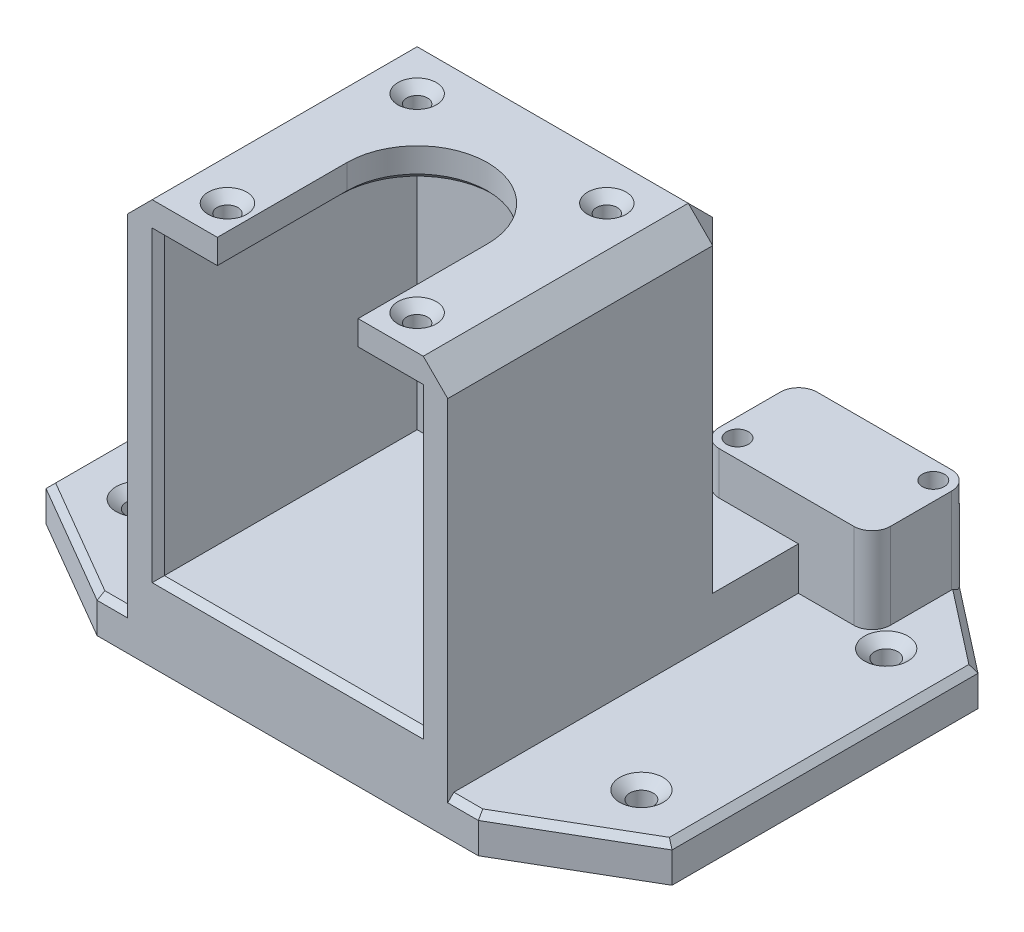
from build123d import *

# Parameters (mm, degrees)
SKETCH2_W                                         = 62.3
SKETCH2_H                                         = 73.3
BOSS_EXTRUDE1_DEPTH                               = 3
BOSS_EXTRUDE3_DEPTH                               = 10
BOSS_EXTRUDE4_DEPTH                               = 48.2
SKETCH13_W                                        = 52.3
SKETCH13_H                                        = 47.3
BOSS_EXTRUDE5_DEPTH                               = 5
CUT_EXTRUDE2_REACH                                = 475.855
CSK_FOR_M3_FLAT_HEAD_MACHINE_SCREW1_D             = 3.4
CSK_FOR_M3_FLAT_HEAD_MACHINE_SCREW1_DEPTH         = 5
CSK_FOR_M3_FLAT_HEAD_MACHINE_SCREW1_CSINK_D       = 6.3
CSK_FOR_M3_FLAT_HEAD_MACHINE_SCREW1_CSINK_ANGLE   = 90
CHAMFER1_SIZE                                     = 1
BOSS_EXTRUDE7_DEPTH                               = 20
BOSS_EXTRUDE6_START                               = -6
BOSS_EXTRUDE6_OUTLINE_W                           = 14
BOSS_EXTRUDE6_OUTLINE_H                           = 20.4
BOSS_EXTRUDE6_DEPTH                               = 6
CHAMFER5_SIZE                                     = 10
CHAMFER2_SIZE                                     = 4
CSK_FOR_6_FLAT_HEAD_MACHINE_SCREW_100_D           = 3.7973
CSK_FOR_6_FLAT_HEAD_MACHINE_SCREW_100_CSINK_D     = 7.0866
CSK_FOR_6_FLAT_HEAD_MACHINE_SCREW_100_CSINK_ANGLE = 100
CHAMFER3_SIZE                                     = 1
F_3_0MM_DOWEL_HOLE1_D                             = 3.5
F_3_32_0_140625_DOWEL_HOLE1_D                     = 3.571875
HOLE4_D                                           = 5.64
HOLE4_DEPTH                                       = 4.2
CUT_EXTRUDE3_DEPTH                                = 4.2
CHAMFER4_SIZE                                     = 0.2


# Read off the part's stored shape, not the designer's step: Boss-Extrude6
with BuildPart() as part:
    # Sketch2 → Boss-Extrude1 (new body)
    with BuildSketch(Plane(origin=(0, -39.89907595, 0), x_dir=(1, 0, 0), z_dir=(0, 1, 0))):
        with Locations((-296.943004764, -298.776222799)):
            Rectangle(SKETCH2_W, SKETCH2_H)
    extrude(amount=BOSS_EXTRUDE1_DEPTH)

    # Sketch4 → Boss-Extrude3 (add)
    with BuildSketch(Plane(origin=(0, -36.89907595, 0), x_dir=(1, 0, 0), z_dir=(0, 1, 0))):
        Polygon((-323.093004764, -262.126222799), (-303.943004764, -262.126222799), (-303.943004764, -282.526222799), (-289.943004764, -282.526222799), (-289.943004764, -262.126222799), (-270.793004764, -262.126222799), (-270.793004764, -335.426222799), (-323.093004764, -335.426222799), align=None)
    extrude(amount=BOSS_EXTRUDE3_DEPTH)

    # Sketch5 → Boss-Extrude4 (add)
    with BuildSketch(Plane(origin=(0, -26.89907595, 0), x_dir=(1, 0, 0), z_dir=(0, 1, 0))):
        Polygon((-270.793004764, -288.126222799), (-323.093004764, -288.126222799), (-323.093004764, -335.426222799), (-318.093004764, -335.426222799), (-318.093004764, -293.126222799), (-275.793004764, -293.126222799), (-275.793004764, -335.426222799), (-270.793004764, -335.426222799), align=None)
    extrude(amount=BOSS_EXTRUDE4_DEPTH)

    # Sketch13 → Boss-Extrude5 (add)
    with BuildSketch(Plane(origin=(0, 21.30092405, 0), x_dir=(1, 0, 0), z_dir=(0, 1, 0))):
        with Locations((-296.943004764, -311.776222799)):
            Rectangle(SKETCH13_W, SKETCH13_H)
    extrude(amount=BOSS_EXTRUDE5_DEPTH)

    # Sketch15 → Cut-Extrude2 (cut, up to next)
    with BuildSketch(Plane(origin=(0, 26.30092405, 0), x_dir=(1, 0, 0), z_dir=(0, 1, 0)), mode=Mode.PRIVATE) as cut_extrude2_sk1:
        with BuildLine():
            Line((-308.443004764, -314.276222799), (-308.443004764, -335.426222799))
            Line((-308.443004764, -335.426222799), (-285.443004764, -335.426222799))
            Line((-285.443004764, -335.426222799), (-285.443004764, -314.276222799))
            ThreePointArc((-285.443004764, -314.276222799), (-296.943004764, -302.776222799), (-308.443004764, -314.276222799))
        make_face()
    cut_extrude2_tool1 = extrude(cut_extrude2_sk1.sketch, amount=-CUT_EXTRUDE2_REACH, mode=Mode.PRIVATE) & part.part
    add(cut_extrude2_tool1.solids().sort_by_distance((-296.943005, 26.300924, 320.226042))[0], mode=Mode.SUBTRACT)

    # CSK for M3 Flat Head Machine Screw1
    with Locations(Plane(origin=(0, 26.30092405, 0), x_dir=(1, 0, 0), z_dir=(0, 1, 0))):
        with Locations((-312.443004764, -298.776222799), (-281.443004764, -298.776222799), (-281.443004764, -329.776222799), (-312.443004764, -329.776222799)):
            CounterSinkHole(CSK_FOR_M3_FLAT_HEAD_MACHINE_SCREW1_D / 2, CSK_FOR_M3_FLAT_HEAD_MACHINE_SCREW1_CSINK_D / 2, depth=CSK_FOR_M3_FLAT_HEAD_MACHINE_SCREW1_DEPTH, counter_sink_angle=CSK_FOR_M3_FLAT_HEAD_MACHINE_SCREW1_CSINK_ANGLE)

    # Chamfer1
    chamfer1_edges = [part.edges().sort_by_distance(p)[0] for p in [
        (-296.943004764, -26.89907595, 335.426222799),
        (-275.793004764, -2.79907595, 335.426222799),
        (-318.093004764, -2.79907595, 335.426222799),
        (-313.268004764, 21.30092405, 335.426222799),
        (-280.618004764, 21.30092405, 335.426222799),
        (-308.443004764, 21.30092405, 324.851222799),
        (-285.443004764, 21.30092405, 324.851222799),
        (-296.943004764, 21.30092405, 302.776222799),
    ]]
    chamfer(chamfer1_edges, length=CHAMFER1_SIZE)

    # Sketch28 → Boss-Extrude7 (add)
    with BuildSketch(Plane(origin=(-288.526747439, -39.89907595, 232.373479331), x_dir=(1, 0, 0), z_dir=(0, 1, 0))):
        with BuildLine():
            Line((29.783182259, -35.452743468), (29.783182259, -32.752743468))
            ThreePointArc((29.783182259, -32.752743468), (28.904502603, -30.631423124), (26.783182259, -29.752743468))
            Line((26.783182259, -29.752743468), (24.083182259, -29.752743468))
            Line((24.083182259, -29.752743468), (4.783182369, -29.752743468))
            ThreePointArc((4.783182369, -29.752743468), (2.661862025, -30.631423124), (1.783182369, -32.752743468))
            Line((1.783182369, -32.752743468), (1.783182259, -40.052743468))
            Line((1.783182259, -40.052743468), (1.783182259, -42.752743468))
            ThreePointArc((1.783182259, -42.752743468), (2.661861916, -44.874063811), (4.783182259, -45.752743468))
            Line((4.783182259, -45.752743468), (7.483182259, -45.752743468))
            Line((7.483182259, -45.752743468), (26.783182369, -45.752743468))
            ThreePointArc((26.783182369, -45.752743468), (28.904502712, -44.874063811), (29.783182369, -42.752743468))
            Line((29.783182369, -42.752743468), (29.783182259, -35.452743468))
        make_face()
    extrude(amount=BOSS_EXTRUDE7_DEPTH)

    # Boss-Extrude6 outline → Boss-Extrude6 (add)
    with BuildSketch(Plane.XZ.offset(39.89907595).offset(BOSS_EXTRUDE6_START)):
        with Locations((-296.943004764, 272.326222799)):
            Rectangle(BOSS_EXTRUDE6_OUTLINE_W, BOSS_EXTRUDE6_OUTLINE_H)
        with BuildLine():
            ThreePointArc((-258.743565179, 265.126222799), (-258.971926582, 263.978172502), (-259.622244836, 263.004902456))
            Line((-259.622244836, 263.004902456), (-245.793004764, 273.776222799))
            Line((-245.793004764, 273.776222799), (-245.793004764, 323.776222799))
            Line((-245.793004764, 323.776222799), (-265.793004764, 335.426222799))
            Line((-265.793004764, 335.426222799), (-270.793004764, 335.426222799))
            Line((-270.793004764, 335.426222799), (-270.793004764, 278.126222799))
            Line((-270.793004764, 278.126222799), (-261.74356507, 278.126222799))
            ThreePointArc((-261.74356507, 278.126222799), (-259.622244726, 277.247543143), (-258.74356507, 275.126222799))
            Line((-258.74356507, 275.126222799), (-258.743565179, 265.126222799))
        make_face()
        Polygon((-328.093004764, 262.126222799), (-323.093004764, 262.126222799), (-323.093004764, 335.426222799), (-328.093004764, 335.426222799), (-348.093004764, 323.776222799), (-348.093004764, 273.776222799), align=None)
    extrude(amount=BOSS_EXTRUDE6_DEPTH)

    # Chamfer5
    chamfer5_edges = [part.edges().sort_by_distance(p)[0] for p in [
        (-323.093004764, -30.39907595, 262.126222799),
    ]]
    chamfer(chamfer5_edges, length=CHAMFER5_SIZE)

    # Chamfer2
    chamfer2_edges = [part.edges().sort_by_distance(p)[0] for p in [
        (-270.793004764, -0.29907595, 288.126222799),
        (-323.093004764, -0.29907595, 288.126222799),
        (-296.943004764, 26.30092405, 288.126222799),
        (-323.093004764, 26.30092405, 311.776222799),
        (-270.793004764, 26.30092405, 311.776222799),
    ]]
    chamfer(chamfer2_edges, length=CHAMFER2_SIZE)

    # CSK for #6 Flat Head Machine Screw (100)1 (through all)
    with Locations(Plane(origin=(0, -33.89907595, 0), x_dir=(1, 0, 0), z_dir=(0, 1, 0))):
        with Locations((-338.093004764, -278.776222799), (-338.093004764, -318.776222799), (-255.793004764, -318.776222799), (-255.793004764, -278.776222799)):
            CounterSinkHole(CSK_FOR_6_FLAT_HEAD_MACHINE_SCREW_100_D / 2, CSK_FOR_6_FLAT_HEAD_MACHINE_SCREW_100_CSINK_D / 2, counter_sink_angle=CSK_FOR_6_FLAT_HEAD_MACHINE_SCREW_100_CSINK_ANGLE)

    # Chamfer3
    chamfer3_edges = [part.edges().sort_by_distance(p)[0] for p in [
        (-286.843284917, -26.89907595, 262.126222799),
        (-268.293004764, -33.89907595, 335.426222799),
        (-303.943004764, -26.89907595, 272.326222799),
        (-255.793004764, -33.89907595, 329.601222799),
        (-245.793004764, -33.89907595, 298.776222799),
        (-252.7076248, -33.89907595, 268.390562628),
        (-308.518004764, -26.89907595, 262.126222799),
        (-348.093004764, -33.89907595, 298.776222799),
        (-338.093004764, -33.89907595, 329.601222799),
        (-325.593004764, -33.89907595, 335.426222799),
        (-318.093004764, -33.89907595, 262.126222799),
        (-338.093004764, -33.89907595, 267.951222799),
        (-289.943004764, -26.89907595, 272.326222799),
        (-296.943004764, -26.89907595, 282.526222799),
        (-323.093004764, -26.89907595, 282.126222799),
        (-318.093004764, -26.89907595, 267.126222799),
    ]]
    chamfer(chamfer3_edges, length=CHAMFER3_SIZE)

    # Ø3.0mm Dowel Hole1 (through all)
    with Locations(Plane(origin=(0, -33.89907595, 0), x_dir=(1, 0, 0), z_dir=(0, 1, 0))):
        with Locations((-296.943004764, -272.326222799)):
            Hole(F_3_0MM_DOWEL_HOLE1_D / 2)

    # 3/32 (0.140625) Dowel Hole1 (through all)
    with Locations(Plane(origin=(0, -19.89907595, 0), x_dir=(1, 0, 0), z_dir=(0, 1, 0))):
        with Locations((-283.743565179, -275.126222799), (-261.743565179, -265.126222799)):
            Hole(F_3_32_0_140625_DOWEL_HOLE1_D / 2)

    # Hole4
    with Locations(Plane(origin=(0, -39.89907595, 0), x_dir=(-1, 0, 0), z_dir=(0, -1, 0))):
        with Locations((296.943004764, -272.326222799)):
            Hole(HOLE4_D / 2, depth=HOLE4_DEPTH)

    # Sketch36 → Cut-Extrude3 (cut)
    with BuildSketch(Plane.XZ.offset(39.89907595)):
        Polygon((-298.571132523, 275.146222799), (-295.314877005, 275.146222799), (-293.686749245, 272.326222799), (-295.314877005, 269.506222799), (-298.571132523, 269.506222799), (-300.199260282, 272.326222799), align=None)
    extrude(amount=-CUT_EXTRUDE3_DEPTH, mode=Mode.SUBTRACT)

    # Chamfer4
    chamfer4_edges = [part.edges().sort_by_distance(p)[0] for p in [
        (-296.943004764, -39.89907595, 275.146222799),
        (-299.385196402, -39.89907595, 273.736222799),
        (-299.385196402, -39.89907595, 270.916222799),
        (-296.943004764, -39.89907595, 269.506222799),
        (-294.500813125, -39.89907595, 270.916222799),
        (-294.500813125, -39.89907595, 273.736222799),
    ]]
    chamfer(chamfer4_edges, length=CHAMFER4_SIZE)


solid = part.part
